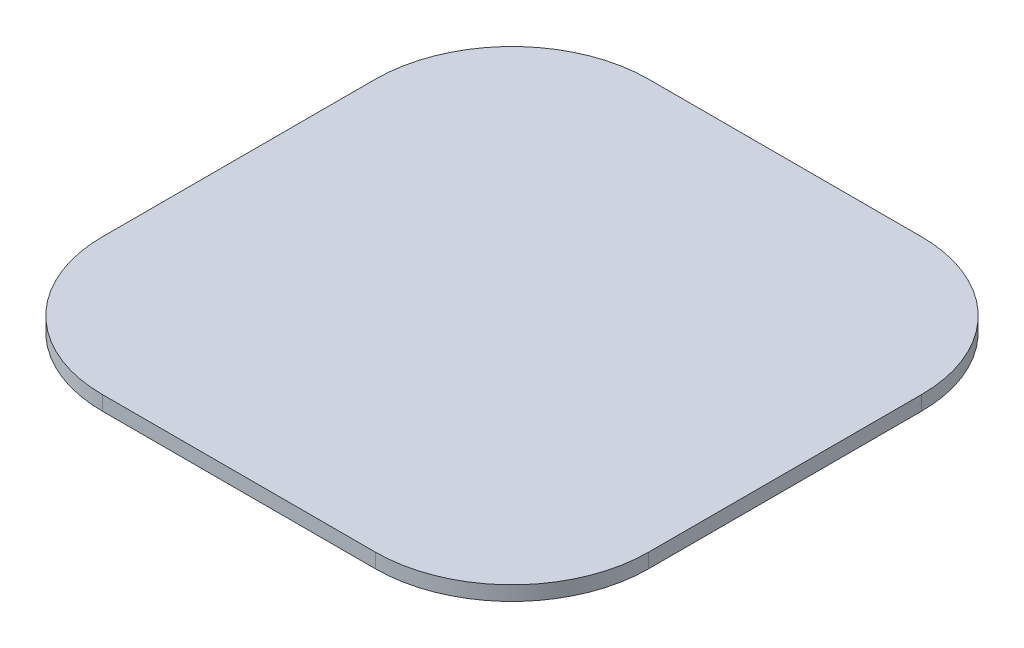
from build123d import *

# Parameters (mm, degrees)
BOSS_EXTRUDE1_DEPTH = 3.175


with BuildPart() as part:
    # Sketch1 → Boss-Extrude1 (new body)
    with BuildSketch(Plane(origin=(0, 0, 0), x_dir=(1, 0, 0), z_dir=(0, 1, 0))):
        with BuildLine():
            Line((-30, 60), (30, 60))
            ThreePointArc((30, 60), (51.213203436, 51.213203436), (60, 30))
            Line((60, 30), (60, -30))
            ThreePointArc((60, -30), (51.213203436, -51.213203436), (30, -60))
            Line((30, -60), (-30, -60))
            ThreePointArc((-30, -60), (-51.213203436, -51.213203436), (-60, -30))
            Line((-60, -30), (-60, 30))
            ThreePointArc((-60, 30), (-51.213203436, 51.213203436), (-30, 60))
        make_face()
    extrude(amount=BOSS_EXTRUDE1_DEPTH)


solid = part.part
